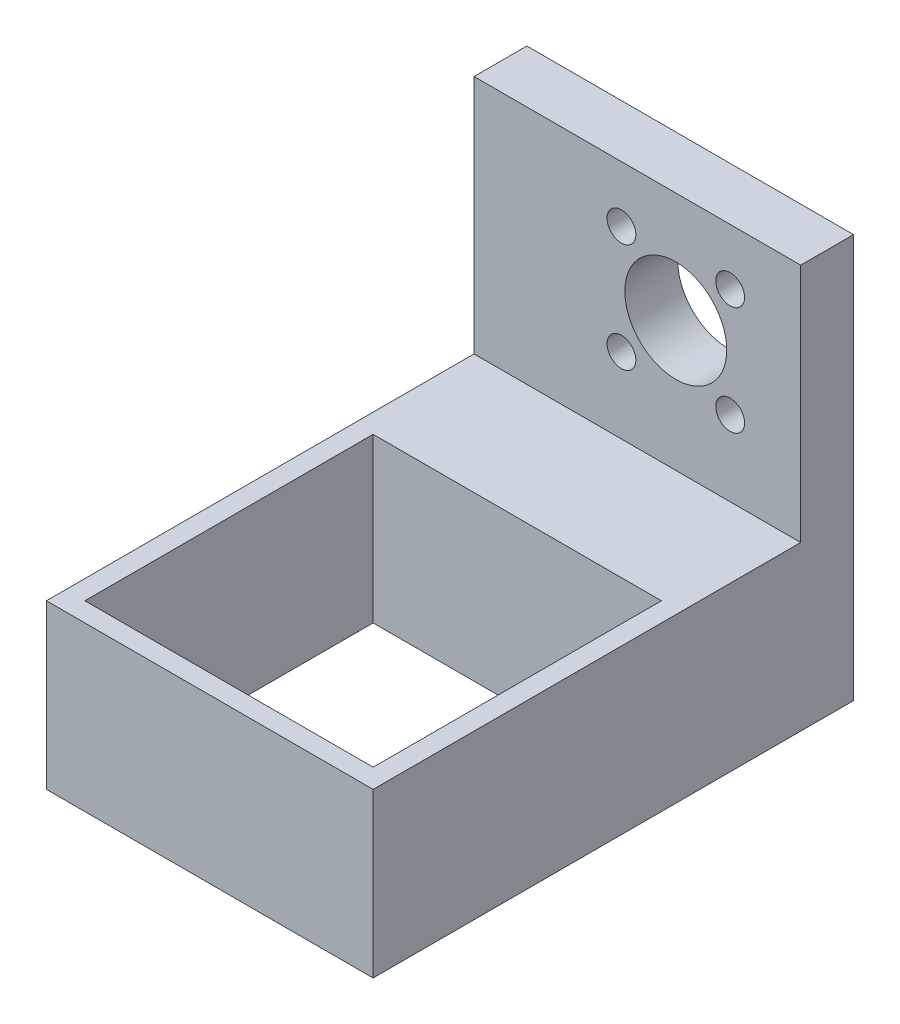
from build123d import *

# Parameters (mm, degrees)
SZKIC1_W                    = 34
SZKIC1_H                    = 50
DODANIE_WYCI_GNI_CIE1_DEPTH = 17
SZKIC2_W                    = 30
SZKIC2_H                    = 30
WYTNIJ_WYCI_GNI_CIE1_DEPTH  = 20
SZKIC3_W                    = 34
SZKIC3_H                    = 5.5
DODANIE_WYCI_GNI_CIE2_DEPTH = 25
SZKIC4_R                    = 1.5
SZKIC4_R_2                  = 5.3
WYTNIJ_WYCI_GNI_CIE2_DEPTH  = 25


with BuildPart() as part:
    # Szkic1 → Dodanie-wyciągnięcie1 (new body)
    with BuildSketch(Plane(origin=(0, 0, 0), x_dir=(1, 0, 0), z_dir=(0, 1, 0))):
        Rectangle(SZKIC1_W, SZKIC1_H)
    extrude(amount=DODANIE_WYCI_GNI_CIE1_DEPTH)

    # Szkic2 → Wytnij-wyciągnięcie1 (cut)
    with BuildSketch(Plane(origin=(0, 17, 0), x_dir=(1, 0, 0), z_dir=(0, 1, 0))):
        with Locations((0, -8)):
            Rectangle(SZKIC2_W, SZKIC2_H)
    extrude(amount=-WYTNIJ_WYCI_GNI_CIE1_DEPTH, mode=Mode.SUBTRACT)

    # Szkic3 → Dodanie-wyciągnięcie2 (add)
    with BuildSketch(Plane(origin=(0, 17, 0), x_dir=(1, 0, 0), z_dir=(0, 1, 0))):
        with Locations((0, 22.25)):
            Rectangle(SZKIC3_W, SZKIC3_H)
    extrude(amount=DODANIE_WYCI_GNI_CIE2_DEPTH)

    # Szkic4 → Wytnij-wyciągnięcie2 (cut)
    with BuildSketch(Plane(origin=(0, 0, -25), x_dir=(-1, 0, 0), z_dir=(0, 0, -1))):
        with Locations((1.656854249, 36.156854249)):
            Circle(SZKIC4_R)
        with Locations((-9.656854249, 36.156854249)):
            Circle(SZKIC4_R)
        with Locations((1.656854249, 24.843145751)):
            Circle(SZKIC4_R)
        with Locations((-9.656854249, 24.843145751)):
            Circle(SZKIC4_R)
        with Locations((-4, 30.5)):
            Circle(SZKIC4_R_2)
    extrude(amount=-WYTNIJ_WYCI_GNI_CIE2_DEPTH, mode=Mode.SUBTRACT)


solid = part.part
